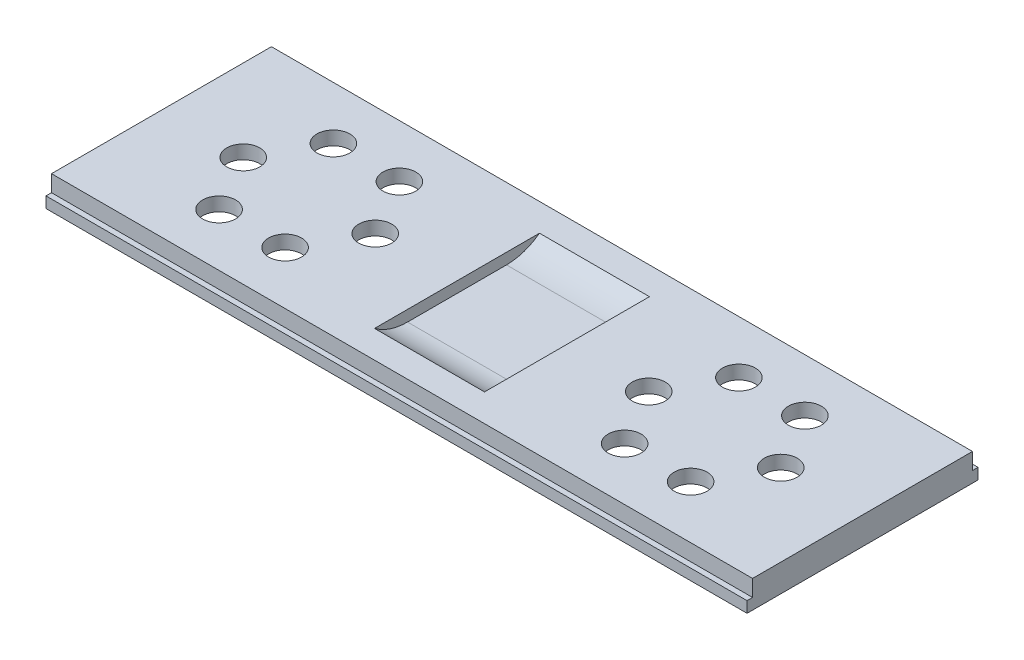
from build123d import *

# Parameters (mm, degrees)
SKETCH1_W           = 127.5
SKETCH1_H           = 42
BOSS_EXTRUDE1_DEPTH = 5
SKETCH2_W           = 127.5
SKETCH2_H           = 1
CUT_EXTRUDE1_DEPTH  = 3
SKETCH7_W           = 20
SKETCH7_H           = 30
CUT_EXTRUDE5_DEPTH  = 2
SHELL8_START        = -14.893859366
SHELL8_DEPTH        = 35
FILLET3_R           = 10
FILLET4_R           = 10
SKETCH10_R          = 3
CUT_EXTRUDE6_DEPTH  = 2.5


# Read off the part's stored shape, not the designer's step: Shell8
with BuildPart() as part:
    # Sketch1 → Boss-Extrude1 (new body)
    with BuildSketch(Plane(origin=(0, 0, 0), x_dir=(1, 0, 0), z_dir=(0, 1, 0))):
        with Locations((12.48267617, -2.606140634)):
            Rectangle(SKETCH1_W, SKETCH1_H)
    extrude(amount=BOSS_EXTRUDE1_DEPTH)

    # Sketch2 → Cut-Extrude1 (cut)
    with BuildSketch(Plane(origin=(0, 5, 0), x_dir=(1, 0, 0), z_dir=(0, 1, 0))):
        with Locations((12.48267617, 17.893859366)):
            Rectangle(SKETCH2_W, SKETCH2_H)
        with Locations((12.48267617, -23.106140634)):
            Rectangle(SKETCH2_W, SKETCH2_H)
    extrude(amount=-CUT_EXTRUDE1_DEPTH, mode=Mode.SUBTRACT)

    # Sketch7 → Cut-Extrude5 (cut)
    with BuildSketch(Plane(origin=(0, 5, 0), x_dir=(1, 0, 0), z_dir=(0, 1, 0))):
        with Locations((12.48267617, -2.606140634)):
            Rectangle(SKETCH7_W, SKETCH7_H)
    extrude(amount=-CUT_EXTRUDE5_DEPTH, mode=Mode.SUBTRACT)

    # Shell8 outline → Shell8 (cut)
    with BuildSketch(Plane.XY.offset(SHELL8_START)):
        Polygon((-0.01732383, 0.5), (-0.01732383, 2.5), (-48.76732383, 2.5), (-48.76732383, 0), (73.73267617, 0), (73.73267617, 2.5), (24.98267617, 2.5), (24.98267617, 0.5), align=None)
    extrude(amount=SHELL8_DEPTH, mode=Mode.SUBTRACT)

    # Fillet3
    # the kernel refuses this fillet: 10 mm, written as the material it adds along each edge
    with BuildSketch(Plane(origin=(37.48267617, 3, 17.606140634), x_dir=(0, 1, 0), z_dir=(-1, 0, 0))) as fillet3_piece_1:
        with BuildLine():
            CenterArc((10, 6), FILLET3_R, 180, 36.869897646)
            Line((0, 6), (-0.2, 6))
            Line((-0.2, 6), (-0.2, 0))
            Line((-0.2, 0), (0, -0.2))
            ThreePointArc((0, -0.2), (1, -0.2), (1.84, -0.12))
            Line((1.84, -0.12), (2, 0))
        make_face()
    extrude(amount=50)

    # Fillet4
    # the kernel refuses this fillet: 10 mm, written as the material it adds along each edge
    with BuildSketch(Plane(origin=(-12.51732383, 3, -12.393859366), x_dir=(0, 0, 1), z_dir=(1, 0, 0))) as fillet4_piece_1:
        with BuildLine():
            CenterArc((6, -10), FILLET4_R, 90, 36.869897646)
            Line((0, -2), (-0.12, -1.84))
            ThreePointArc((-0.12, -1.84), (-0.2, -1), (-0.2, 0))
            Line((-0.2, 0), (0, 0.2))
            Line((0, 0.2), (6, 0.2))
            Line((6, 0.2), (6, 0))
        make_face()
    extrude(amount=50)

    # Sketch10 → Cut-Extrude6 (cut)
    with BuildSketch(Plane(origin=(0, 5, 0), x_dir=(1, 0, 0), z_dir=(0, 1, 0))):
        with Locations(Location((-12.39232383, -2.606140634, 0), (0, 0, 270))):
            Circle(SKETCH10_R)
        with Locations(Location((-18.39232383, -12.998445479, 0), (0, 0, 270))):
            Circle(SKETCH10_R)
        with Locations(Location((-30.39232383, -12.998445479, 0), (0, 0, 270))):
            Circle(SKETCH10_R)
        with Locations(Location((-36.39232383, -2.606140634, 0), (0, 0, 270))):
            Circle(SKETCH10_R)
        with Locations(Location((-30.39232383, 7.786164212, 0), (0, 0, 270))):
            Circle(SKETCH10_R)
        with Locations(Location((-18.39232383, 7.786164212, 0), (0, 0, 270))):
            Circle(SKETCH10_R)
        with Locations(Location((61.35767617, -2.606140634, 0), (0, 0, 270))):
            Circle(SKETCH10_R)
        with Locations(Location((55.35767617, -12.998445479, 0), (0, 0, 270))):
            Circle(SKETCH10_R)
        with Locations(Location((43.35767617, -12.998445479, 0), (0, 0, 270))):
            Circle(SKETCH10_R)
        with Locations(Location((37.35767617, -2.606140634, 0), (0, 0, 270))):
            Circle(SKETCH10_R)
        with Locations(Location((43.35767617, 7.786164212, 0), (0, 0, 270))):
            Circle(SKETCH10_R)
        with Locations(Location((55.35767617, 7.786164212, 0), (0, 0, 270))):
            Circle(SKETCH10_R)
    extrude(amount=-CUT_EXTRUDE6_DEPTH, mode=Mode.SUBTRACT)


solid = part.part
